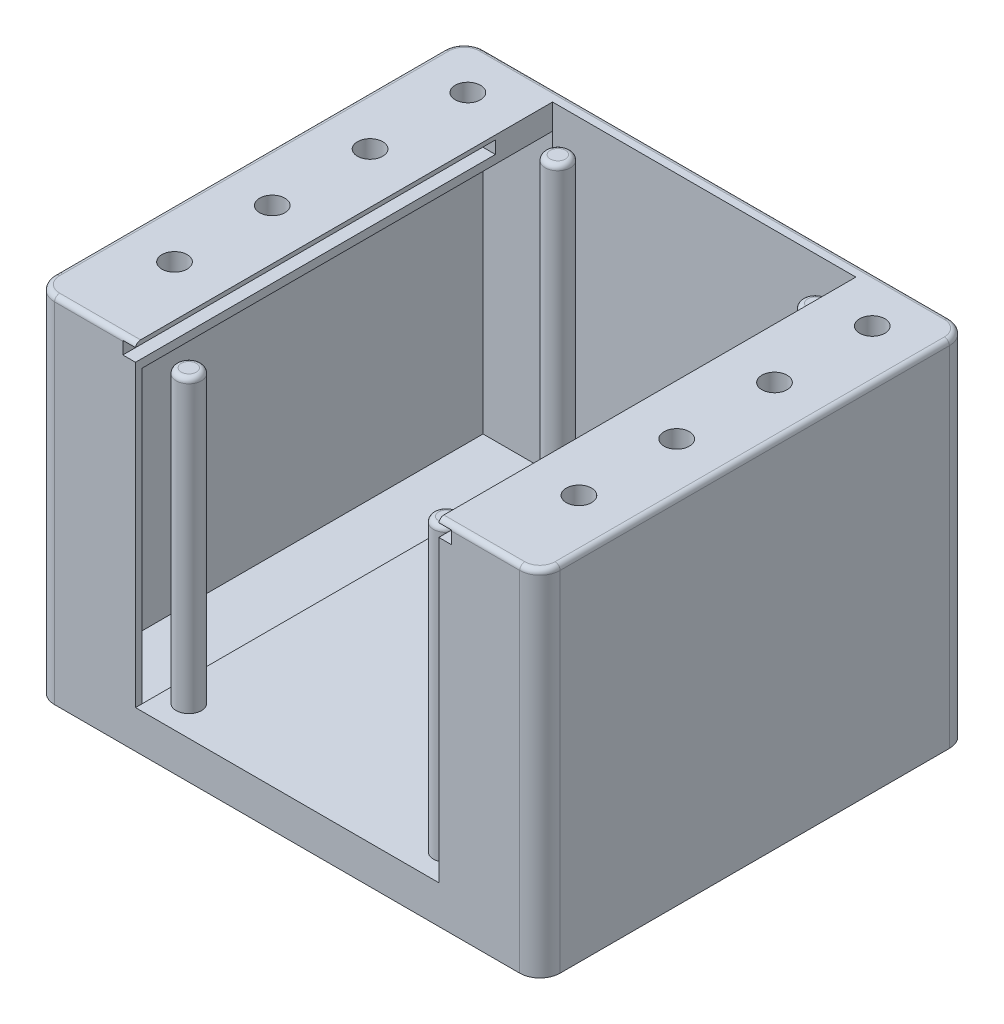
from build123d import *

# Parameters (mm, degrees)
SKETCH1_W               = 508
SKETCH1_H               = 431.8
BOSS_EXTRUDE1_DEPTH     = 355.6
SKETCH2_W               = 304.8
SKETCH2_H               = 419.1
CUT_EXTRUDE1_DEPTH      = 317.5
SKETCH3_W               = 419.1
SKETCH3_H               = 304.8
CUT_EXTRUDE2_DEPTH      = 76.2
CUT_EXTRUDE3_REACH      = 489.422
SKETCH4_R               = 12.7
LPATTERN1_COUNT         = 4
LPATTERN1_PITCH         = 98.26
MIRROR2_COPY_1_REACH    = 489.422
MIRROR2_COPY_1_SKETCH_R = 12.7
MIRROR2_COPY_2_REACH    = 489.422
MIRROR2_COPY_2_SKETCH_R = 12.7
MIRROR2_COPY_3_REACH    = 489.422
MIRROR2_COPY_3_SKETCH_R = 12.7
CUT_EXTRUDE4_START      = -361.696
SKETCH6_W               = 12.7
SKETCH6_H               = 12.7
CUT_EXTRUDE4_DEPTH      = 977.04004042
SKETCH8_R               = 12.7
BOSS_EXTRUDE2_DEPTH     = 292.1
FILLET1_R               = 5.08
FILLET2_R               = 20.32


with BuildPart() as part:
    # Sketch1 → Boss-Extrude1 (new body)
    with BuildSketch(Plane(origin=(0, 0, 0), x_dir=(1, 0, 0), z_dir=(0, 1, 0))):
        Rectangle(SKETCH1_W, SKETCH1_H)
    extrude(amount=BOSS_EXTRUDE1_DEPTH)

    # Sketch2 → Cut-Extrude1 (cut)
    with BuildSketch(Plane(origin=(0, 355.6, 0), x_dir=(1, 0, 0), z_dir=(0, 1, 0))):
        with Locations((0, -6.35)):
            Rectangle(SKETCH2_W, SKETCH2_H)
    extrude(amount=-CUT_EXTRUDE1_DEPTH, mode=Mode.SUBTRACT)

    # Sketch3 → Cut-Extrude2 (cut)
    with BuildSketch(Plane.ZY.offset(-152.4)):
        with Locations((0, 177.8)):
            Rectangle(SKETCH3_W, SKETCH3_H)
    cut_extrude2 = extrude(amount=-CUT_EXTRUDE2_DEPTH, mode=Mode.SUBTRACT)

    # Sketch4 → Cut-Extrude3 (cut, up to next)
    with BuildSketch(Plane(origin=(0, 355.6, 0), x_dir=(1, 0, 0), z_dir=(0, 1, 0)), mode=Mode.PRIVATE) as cut_extrude3_sk1:
        with Locations(Location((203.2, 168.878965906, 0), (0, 0, 270))):
            Circle(SKETCH4_R)
    cut_extrude3_tool1 = extrude(cut_extrude3_sk1.sketch, amount=-CUT_EXTRUDE3_REACH, mode=Mode.PRIVATE) & part.part
    cut_extrude3 = cut_extrude3_tool1.solids().sort_by_distance((203.2, 355.6, -168.878966))[0]
    add(cut_extrude3, mode=Mode.SUBTRACT)

    # LPattern1: Cut-Extrude3 ×4
    with Locations(*[(0, 0, i * LPATTERN1_PITCH) for i in range(1, LPATTERN1_COUNT)]):
        add(cut_extrude3, mode=Mode.SUBTRACT)

    # Mirror2: Cut-Extrude2, Cut-Extrude3 across plane
    add(cut_extrude2.mirror(Plane(origin=(0, 0, 0), x_dir=(0, 0, 1), z_dir=(1, 0, 0))), mode=Mode.SUBTRACT)
    add(cut_extrude3.mirror(Plane(origin=(0, 0, 0), x_dir=(0, 0, 1), z_dir=(1, 0, 0))), mode=Mode.SUBTRACT)

    # Mirror2 copy 1 sketch → Mirror2 copy 1 (cut, up to next)
    with BuildSketch(Plane(origin=(0, 355.6, 98.26), x_dir=(-1, 0, 0), z_dir=(0, 1, 0)), mode=Mode.PRIVATE) as mirror2_copy_1_sk1:
        with Locations((203.2, -168.878965906)):
            Circle(MIRROR2_COPY_1_SKETCH_R)
    mirror2_copy_1_tool1 = extrude(mirror2_copy_1_sk1.sketch, amount=-MIRROR2_COPY_1_REACH, mode=Mode.PRIVATE) & part.part
    add(mirror2_copy_1_tool1.solids().sort_by_distance((-203.2, 355.6, -70.618966))[0], mode=Mode.SUBTRACT)

    # Mirror2 copy 2 sketch → Mirror2 copy 2 (cut, up to next)
    with BuildSketch(Plane(origin=(0, 355.6, 196.52), x_dir=(-1, 0, 0), z_dir=(0, 1, 0)), mode=Mode.PRIVATE) as mirror2_copy_2_sk1:
        with Locations((203.2, -168.878965906)):
            Circle(MIRROR2_COPY_2_SKETCH_R)
    mirror2_copy_2_tool1 = extrude(mirror2_copy_2_sk1.sketch, amount=-MIRROR2_COPY_2_REACH, mode=Mode.PRIVATE) & part.part
    add(mirror2_copy_2_tool1.solids().sort_by_distance((-203.2, 355.6, 27.641034))[0], mode=Mode.SUBTRACT)

    # Mirror2 copy 3 sketch → Mirror2 copy 3 (cut, up to next)
    with BuildSketch(Plane(origin=(0, 355.6, 294.78), x_dir=(-1, 0, 0), z_dir=(0, 1, 0)), mode=Mode.PRIVATE) as mirror2_copy_3_sk1:
        with Locations((203.2, -168.878965906)):
            Circle(MIRROR2_COPY_3_SKETCH_R)
    mirror2_copy_3_tool1 = extrude(mirror2_copy_3_sk1.sketch, amount=-MIRROR2_COPY_3_REACH, mode=Mode.PRIVATE) & part.part
    add(mirror2_copy_3_tool1.solids().sort_by_distance((-203.2, 355.6, 125.901034))[0], mode=Mode.SUBTRACT)

    # Sketch6 → Cut-Extrude4 (cut)
    with BuildSketch(Plane.XY.offset(215.9).offset(CUT_EXTRUDE4_START)):
        with Locations((158.75, 344.990083106)):
            Rectangle(SKETCH6_W, SKETCH6_H)
    cut_extrude4 = extrude(amount=CUT_EXTRUDE4_DEPTH, mode=Mode.SUBTRACT)

    # Mirror3: Cut-Extrude4 across plane
    add(cut_extrude4.mirror(Plane(origin=(0, 0, 0), x_dir=(0, 0, 1), z_dir=(1, 0, 0))), mode=Mode.SUBTRACT)

    # Sketch8 → Boss-Extrude2 (add)
    with BuildSketch(Plane(origin=(0, 38.1, 0), x_dir=(1, 0, 0), z_dir=(0, 1, 0))):
        with Locations(Location((-129.286, 185.42, 0), (0, 0, 90))):
            Circle(SKETCH8_R)
        with Locations(Location((-129.286, -185.42, 0), (0, 0, 90))):
            Circle(SKETCH8_R)
    boss_extrude2 = extrude(amount=BOSS_EXTRUDE2_DEPTH)

    # Mirror4: Boss-Extrude2 across plane
    add(boss_extrude2.mirror(Plane(origin=(0, 0, 0), x_dir=(0, 0, 1), z_dir=(1, 0, 0))))

    # Fillet1
    fillet1_edges = [part.edges().sort_by_distance(p)[0] for p in [
        (129.286, 330.2, -172.72),
        (-129.286, 330.2, -172.72),
        (129.286, 330.2, 198.12),
        (-129.286, 330.2, 198.12),
        (203.2, 355.6, 215.9),
        (254, 355.6, 0),
        (0, 355.6, -215.9),
        (-203.2, 355.6, 215.9),
        (-254, 355.6, 0),
    ]]
    fillet(fillet1_edges, radius=FILLET1_R)

    # Fillet2
    # the kernel refuses this fillet: 20.32 mm, written as the material it takes off along each edge
    with BuildSketch(Plane(origin=(-233.68, 355.6, 195.58), x_dir=(-1, 0, 0), z_dir=(0, 0, -1))) as fillet2_piece_1:
        with BuildLine():
            CenterArc((15.24, -5.08), 5.08, 0, 90)
            Line((20.32, -5.08), (20.32, 0))
            Line((20.32, 0), (15.24, 0))
        make_face()
    revolve(axis=Axis((-233.68, 355.6, 195.58), (0, 1, 0)), revolution_arc=90, mode=Mode.SUBTRACT)
    with BuildSketch(Plane(origin=(-233.68, 355.6, -195.58), x_dir=(0, 0, -1), z_dir=(1, 0, 0))) as fillet2_piece_2:
        with BuildLine():
            CenterArc((15.24, -5.08), 5.08, 0, 90)
            Line((20.32, -5.08), (20.32, 0))
            Line((20.32, 0), (15.24, 0))
        make_face()
    revolve(axis=Axis((-233.68, 355.6, -195.58), (0, 1, 0)), revolution_arc=90, mode=Mode.SUBTRACT)
    with BuildSketch(Plane(origin=(233.68, 355.6, -195.58), x_dir=(1, 0, 0), z_dir=(0, 0, 1))) as fillet2_piece_3:
        with BuildLine():
            CenterArc((15.24, -5.08), 5.08, 0, 90)
            Line((20.32, -5.08), (20.32, 0))
            Line((20.32, 0), (15.24, 0))
        make_face()
    revolve(axis=Axis((233.68, 355.6, -195.58), (0, 1, 0)), revolution_arc=90, mode=Mode.SUBTRACT)
    with BuildSketch(Plane(origin=(233.68, 355.6, 195.58), x_dir=(0, 0, 1), z_dir=(-1, 0, 0))) as fillet2_piece_4:
        with BuildLine():
            CenterArc((15.24, -5.08), 5.08, 0, 90)
            Line((20.32, -5.08), (20.32, 0))
            Line((20.32, 0), (15.24, 0))
        make_face()
    revolve(axis=Axis((233.68, 355.6, 195.58), (0, 1, 0)), revolution_arc=90, mode=Mode.SUBTRACT)
    with BuildSketch(Plane(origin=(-254, -50.8, 215.9), x_dir=(1, 0, 0), z_dir=(0, 1, 0)), Plane(origin=(-254, -50.8, -215.9), x_dir=(0, 0, 1), z_dir=(0, 1, 0))) as fillet2_piece_5:
        with BuildLine():
            CenterArc((FILLET2_R, FILLET2_R), FILLET2_R, 180, 90)
            Line((0, FILLET2_R), (0, 0))
            Line((0, 0), (FILLET2_R, 0))
        make_face()
    extrude(amount=406.4, mode=Mode.SUBTRACT)
    with BuildSketch(Plane(origin=(254, -50.8, 215.9), x_dir=(-1, 0, 0), z_dir=(0, 1, 0)), Plane(origin=(254, -50.8, -215.9), x_dir=(0, 0, 1), z_dir=(0, 1, 0))) as fillet2_piece_6:
        with BuildLine():
            CenterArc((FILLET2_R, -FILLET2_R), FILLET2_R, 90, 90)
            Line((0, -FILLET2_R), (0, 0))
            Line((0, 0), (FILLET2_R, 0))
        make_face()
    extrude(amount=406.4, mode=Mode.SUBTRACT)


solid = part.part
